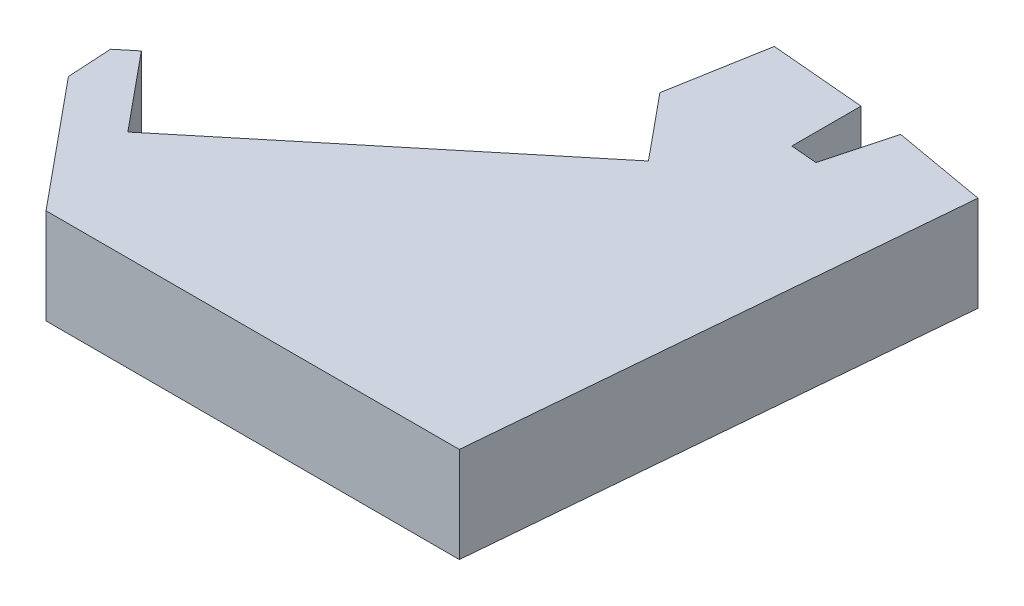
from build123d import *

# Parameters (mm, degrees)
EXTRUDE_1_DEPTH = 18


with BuildPart() as part:
    # 草图1 → 凸台-拉伸1 (new body)
    with BuildSketch(Plane(origin=(0, 0, 0), x_dir=(1, 0, 0), z_dir=(0, 1, 0))):
        Polygon((0, 0), (78, 0), (85.873979717, 90), (68.147440163, 93.125667198), (64.76994017, 80.52066562), (59.788966679, 80.956444333), (59.788966679, 94.006102221), (41.857462113, 95.574905591), (38.620755456, 77.218629971), (48.706191378, 64.981055299), (-5.154322711, 20.592622285), (-17.1280609, 35.121445464), (-20.313395331, 32.496294063), (-19.833529743, 24.065821558), align=None)
    extrude(amount=EXTRUDE_1_DEPTH)


solid = part.part
